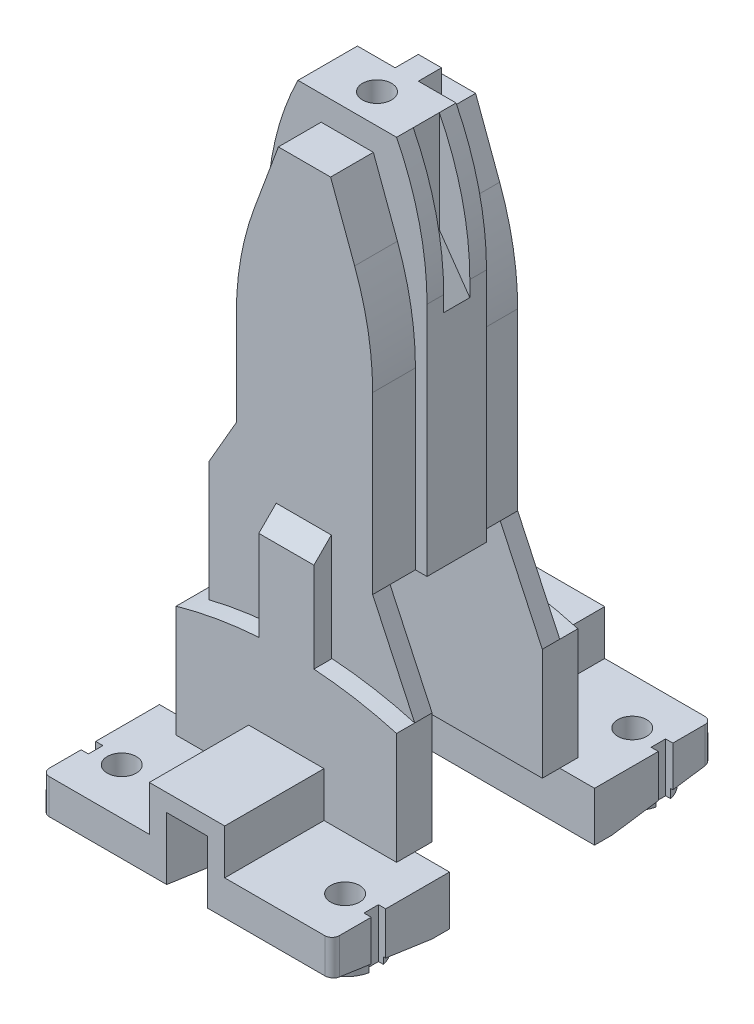
from build123d import *
from OCP.BRepFilletAPI import BRepFilletAPI_MakeChamfer

# Parameters (mm, degrees)
SKETCH1_W                 = 20
SKETCH1_H                 = 26.2
SKETCH1_R                 = 1
BOSS_EXTRUDE1_DEPTH       = 3.4
SKETCH2_W                 = 11
SKETCH2_H                 = 10
BOSS_EXTRUDE2_DEPTH       = 40.8
SKETCH3_W                 = 6.8
SKETCH3_H                 = 4.1
BOSS_EXTRUDE3_DEPTH       = 1.7
SKETCH4_R                 = 1
CUT_EXTRUDE1_DEPTH        = 2
CUT_EXTRUDE2_START        = -10
SKETCH6_W                 = 0.8
SKETCH6_H                 = 27.4
CUT_EXTRUDE2_DEPTH        = 10
BOSS_EXTRUDE4_DEPTH       = 4.1
SKETCH9_W                 = 3.7
SKETCH9_H                 = 4.1
BOSS_EXTRUDE5_DEPTH       = 37.4
SKETCH10_W                = 2.1
SKETCH10_H                = 1.8
CUT_EXTRUDE3_DEPTH        = 7
CHAMFER1_SIZE             = 3
CHAMFER1_SIZE_2           = 2.1
FILLET1_R                 = 20
FILLET2_R                 = 20
SKETCH11_W                = 15.2
SKETCH11_H                = 12.5
BOSS_EXTRUDE6_DEPTH       = 7.7
SKETCH12_W                = 6.6
SKETCH12_H                = 10
BOSS_EXTRUDE7_DEPTH       = 12.5
CHAMFER2_SIZE             = 4
CHAMFER2_SIZE_2           = 2.309401077
BOSS_EXTRUDE8_REACH       = 49.264
BOSS_EXTRUDE9_REACH       = 49.756
SKETCH16_W                = 3.480808908
SKETCH16_H                = 8.4
CUT_EXTRUDE4_DEPTH        = 49.763305876
SKETCH17_W                = 10
SKETCH17_H                = 3.4
CUT_EXTRUDE5_DEPTH        = 49.763305876
BOSS_EXTRUDE10_START      = -26.2
BOSS_EXTRUDE10_DEPTH      = 26.2
SKETCH19_W                = 3.480808908
SKETCH19_H                = 4.2
CUT_EXTRUDE6_DEPTH        = 48.829070658
SKETCH20_W                = 2.8
SKETCH20_H                = 3.4
CUT_EXTRUDE7_DEPTH        = 6.85
SKETCH21_W                = 2.8
SKETCH21_H                = 3.4
CUT_EXTRUDE8_DEPTH        = 6.85
BOSS_EXTRUDE11_START      = -1.2
BOSS_EXTRUDE11_DEPTH      = 1.2
CHAMFER3_SIZE             = 1.2
CHAMFER3_OF_MIRROR10_SIZE = 1.2
FILLET3_R                 = 0.5
CUT_EXTRUDE10_DEPTH       = 49.763305876
CUT_EXTRUDE10_DEPTH_BACK  = 49.763305876
BOSS_EXTRUDE12_START      = -3.4
SKETCH26_R                = 2.2
SKETCH26_R_2              = 1
BOSS_EXTRUDE12_DEPTH      = 3.4
SKETCH27_W                = 1.6
SKETCH27_H                = 1.6
BOSS_EXTRUDE13_DEPTH      = 1.7
CUT_EXTRUDE12_DEPTH       = 29
CUT_EXTRUDE12_DEPTH_BACK  = 10.1
SKETCH28_W                = 7.6
SKETCH28_H                = 15
FILLET4_R                 = 0.5
SKETCH29_W                = 0.5
SKETCH29_H                = 1
CUT_EXTRUDE13_DEPTH       = 43.43135633


# Some blends are built 0.0001 mm under size
with BuildPart() as part:
    # Sketch1 → Boss-Extrude1 (new body)
    with BuildSketch(Plane(origin=(0, 0, 0), x_dir=(1, 0, 0), z_dir=(0, 1, 0))):
        Rectangle(SKETCH1_W, SKETCH1_H)
        with Locations(Location((7.7, 9.9, 0), (0, 0, 270))):
            Circle(SKETCH1_R, mode=Mode.SUBTRACT)
        with Locations(Location((-7.7, 9.9, 0), (0, 0, 90))):
            Circle(SKETCH1_R, mode=Mode.SUBTRACT)
        with Locations(Location((7.7, -9.9, 0), (0, 0, 90))):
            Circle(SKETCH1_R, mode=Mode.SUBTRACT)
        with Locations(Location((-7.7, -9.9, 0), (0, 0, 270))):
            Circle(SKETCH1_R, mode=Mode.SUBTRACT)
    extrude(amount=BOSS_EXTRUDE1_DEPTH)

    # Sketch2 → Boss-Extrude2 (add)
    with BuildSketch(Plane.XZ):
        Rectangle(SKETCH2_W, SKETCH2_H)
    extrude(amount=-BOSS_EXTRUDE2_DEPTH)

    # Sketch3 → Boss-Extrude3 (add)
    with BuildSketch(Plane(origin=(0, 40.8, 0), x_dir=(1, 0, 0), z_dir=(0, 1, 0))):
        Rectangle(SKETCH3_W, SKETCH3_H)
    extrude(amount=BOSS_EXTRUDE3_DEPTH)

    # Sketch4 → Cut-Extrude1 (cut)
    with BuildSketch(Plane(origin=(0, 42.5, 0), x_dir=(1, 0, 0), z_dir=(0, 1, 0))):
        with Locations(Location((0, 0, 0), (0, 0, 270))):
            Circle(SKETCH4_R)
    extrude(amount=-CUT_EXTRUDE1_DEPTH, mode=Mode.SUBTRACT)

    # Sketch6 → Cut-Extrude2 (cut)
    with BuildSketch(Plane.XY.offset(5).offset(CUT_EXTRUDE2_START)):
        with Locations((-5.1, 17.1)):
            Rectangle(SKETCH6_W, SKETCH6_H)
        Polygon((-5.5, 30.8), (-4.7, 32.962162162), (-4.7, 40.8), (-5.5, 40.8), align=None)
        Polygon((-4.7, 30.8), (-4.7, 32.962162162), (-5.5, 30.8), align=None)
        Polygon((-4.7, 32.962162162), (-1.8, 40.8), (-4.7, 40.8), align=None)
        Polygon((4.7, 40.8), (1.8, 40.8), (4.7, 32.962162162), align=None)
        Polygon((5.5, 40.8), (4.7, 40.8), (4.7, 32.962162162), (5.5, 30.8), align=None)
        Polygon((5.5, 30.8), (4.7, 32.962162162), (4.7, 30.8), align=None)
        with Locations((5.1, 17.1)):
            Rectangle(SKETCH6_W, SKETCH6_H)
    cut_extrude2 = extrude(amount=CUT_EXTRUDE2_DEPTH, mode=Mode.SUBTRACT)

    # Sketch7 → Boss-Extrude4 (add)
    with BuildSketch(Plane.XY.offset(2.05)):
        Polygon((-3.4, 42.5), (-5.5, 40.8), (-3.4, 40.8), align=None)
        Polygon((3.4, 42.5), (3.4, 40.8), (5.5, 40.8), align=None)
    extrude(amount=-BOSS_EXTRUDE4_DEPTH)

    # Mirror6: Cut-Extrude2 across plane
    add(cut_extrude2.mirror(Plane.XY), mode=Mode.SUBTRACT)

    # Sketch9 → Boss-Extrude5 (add)
    with BuildSketch(Plane.XZ.offset(-40.8)):
        with Locations((3.65, 0)):
            Rectangle(SKETCH9_W, SKETCH9_H)
        with Locations((-3.65, 0)):
            Rectangle(SKETCH9_W, SKETCH9_H)
    extrude(amount=BOSS_EXTRUDE5_DEPTH)

    # Sketch10 → Cut-Extrude3 (cut)
    with BuildSketch(Plane(origin=(0, 42.5, 0), x_dir=(1, 0, 0), z_dir=(0, 1, 0))):
        with Locations((4.45, 0)):
            Rectangle(SKETCH10_W, SKETCH10_H)
        with Locations((-4.45, 0)):
            Rectangle(SKETCH10_W, SKETCH10_H)
    extrude(amount=-CUT_EXTRUDE3_DEPTH, mode=Mode.SUBTRACT)

    # Chamfer1
    chamfer1_edges_1 = [part.edges().sort_by_distance(p)[0] for p in [
        (-5.5, 35.5, 0),
    ]]
    chamfer1_side_1 = [part.faces().sort_by_distance(p)[0] for p in [
        (-5.5, 35.458, 0),
    ]]
    chamfer1_edges_2 = [part.edges().sort_by_distance(p)[0] for p in [
        (5.5, 35.5, 0),
    ]]
    chamfer1_side_2 = [part.faces().sort_by_distance(p)[0] for p in [
        (5.5, 35.458, 0),
    ]]
    chamfer1 = BRepFilletAPI_MakeChamfer(part.part.solid().wrapped)
    for e in chamfer1_edges_1:
        chamfer1.Add(CHAMFER1_SIZE - 0.0001, CHAMFER1_SIZE_2 - 0.0001, e.wrapped, chamfer1_side_1[0].wrapped)
    for e in chamfer1_edges_2:
        chamfer1.Add(CHAMFER1_SIZE - 0.0001, CHAMFER1_SIZE_2 - 0.0001, e.wrapped, chamfer1_side_2[0].wrapped)
    add(Compound.cast(chamfer1.Shape()), mode=Mode.REPLACE)  # a hair under: the kernel refuses the full size

    # Fillet1
    # the kernel refuses this fillet: 20 mm, written as the material it takes off along each edge
    with BuildSketch(Plane(origin=(5.5, 40.8, 17.15330693), x_dir=(-0.7772448707074852, 0.6291982286679648, 0), z_dir=(0, 0, -1))) as fillet1_piece_1:
        with BuildLine():
            CenterArc((11.001253917, -18.196700658), FILLET1_R, 114.517435757, 26.4915702)
            Line((-4.543643497, -5.612736084), (-4.854541445, -5.361056793))
            Line((-4.854541445, -5.361056793), (-0.310897948, 0.251679291))
            Line((-0.310897948, 0.251679291), (0, 0.4))
            ThreePointArc((0, 0.4), (1.350925609, 0.4), (2.535863163, 0.363934013))
            Line((2.535863163, 0.363934013), (2.701851217, 0))
        make_face()
    extrude(amount=37.256613859, mode=Mode.SUBTRACT)
    with BuildSketch(Plane(origin=(5.5, 40.8, 20.10330693), x_dir=(0, -1, 0), z_dir=(0, 0, -1))) as fillet1_piece_2:
        with BuildLine():
            CenterArc((7.221322772, 20), FILLET1_R, 243.5084298, 26.4915702)
            Line((-1.7, 2.1), (-1.878426455, 1.742))
            ThreePointArc((-1.878426455, 1.742), (-1.160897948, 0.798320709), (-0.310897948, -0.251679291))
            Line((-0.310897948, -0.251679291), (0, -0.4))
            Line((0, -0.4), (7.221322772, -0.4))
            Line((7.221322772, -0.4), (7.221322772, 0))
        make_face()
    extrude(amount=37.256613859, mode=Mode.SUBTRACT)
    with BuildSketch(Plane(origin=(-5.5, 40.8, 20.10330693), x_dir=(0, -1, 0), z_dir=(0, 0, -1)), Plane(origin=(-5.5, 40.8, 17.15330693), x_dir=(0, -1, 0), z_dir=(0, 0, -1))) as fillet1_piece_3:
        with BuildLine():
            CenterArc((7.221322772, -20), FILLET1_R, 90, 26.4915702)
            Line((-1.7, -2.1), (-1.878426455, -1.742))
            ThreePointArc((-1.878426455, -1.742), (-1.160897948, -0.798320709), (-0.310897948, 0.251679291))
            Line((-0.310897948, 0.251679291), (0, 0.4))
            Line((0, 0.4), (7.221322772, 0.4))
            Line((7.221322772, 0.4), (7.221322772, 0))
        make_face()
    extrude(amount=37.256613859, mode=Mode.SUBTRACT)

    # Fillet2
    fillet2_edges = [part.edges().sort_by_distance(p)[0] for p in [
        (4.7, 32.962162162, 3.525),
        (-4.7, 32.962162162, 3.525),
        (-4.7, 32.962162162, -3.525),
        (4.7, 32.962162162, -3.525),
    ]]
    fillet(fillet2_edges, radius=FILLET2_R)

    # Sketch11 → Boss-Extrude6 (add)
    with BuildSketch(Plane(origin=(0, 3.4, 0), x_dir=(1, 0, 0), z_dir=(0, 1, 0))):
        Rectangle(SKETCH11_W, SKETCH11_H)
    extrude(amount=BOSS_EXTRUDE6_DEPTH)

    # Sketch12 → Boss-Extrude7 (add)
    with BuildSketch(Plane(origin=(0, 11.1, 0), x_dir=(1, 0, 0), z_dir=(0, 1, 0))):
        with Locations((-3.3, 0)):
            Rectangle(SKETCH12_W, SKETCH12_H)
    extrude(amount=BOSS_EXTRUDE7_DEPTH)

    # Chamfer2
    # the kernel refuses this chamfer: 4, 2.309401077 mm, written as the material it takes off along each edge
    with BuildSketch(Plane(origin=(-6.6, 23.6, -15.348343019), x_dir=(-0.01932676561270072, -0.9998132206222079, 0), z_dir=(0, 0, 1))) as chamfer2_piece_1_section:
        Polygon((CHAMFER2_SIZE * 0.999813220622, CHAMFER2_SIZE * 0.0193267656127), (-CHAMFER2_SIZE_2 * 0.0193267656107, CHAMFER2_SIZE_2 * 0.999813220518), (0, 0), align=None)
    chamfer2_piece_1 = extrude(amount=30.696686037, mode=Mode.PRIVATE)
    chamfer2_piece_1 = split(chamfer2_piece_1, bisect_by=Plane(origin=(-5.5, 22.026681043, -3.525), z_dir=(-1, 0, 0)), keep=Keep.TOP, mode=Mode.PRIVATE)
    add(chamfer2_piece_1, mode=Mode.SUBTRACT)
    with BuildSketch(Plane(origin=(-6.6, 23.6, -15.348343019), x_dir=(-0.01932676561270072, -0.9998132206222079, 0), z_dir=(0, 0, 1))) as chamfer2_piece_2_section:
        Polygon((CHAMFER2_SIZE * 0.999813220622, CHAMFER2_SIZE * 0.0193267656127), (-CHAMFER2_SIZE_2 * 0.0193267656107, CHAMFER2_SIZE_2 * 0.999813220518), (0, 0), align=None)
    chamfer2_piece_2 = extrude(amount=30.696686037, mode=Mode.PRIVATE)
    chamfer2_piece_2 = split(chamfer2_piece_2, bisect_by=Plane(origin=(-5.165892343, 22.841973663, -2.05), z_dir=(0, 0, -1)), keep=Keep.TOP, mode=Mode.PRIVATE)
    chamfer2_piece_2 = split(chamfer2_piece_2, bisect_by=Plane(origin=(-4.7, 22.841973663, -3.525), z_dir=(-1, 0, 0)), keep=Keep.TOP, mode=Mode.PRIVATE)
    add(chamfer2_piece_2, mode=Mode.SUBTRACT)
    with BuildSketch(Plane(origin=(-6.6, 23.6, -15.348343019), x_dir=(-0.01932676561270072, -0.9998132206222079, 0), z_dir=(0, 0, 1))) as chamfer2_piece_3_section:
        Polygon((CHAMFER2_SIZE * 0.999813220622, CHAMFER2_SIZE * 0.0193267656127), (-CHAMFER2_SIZE_2 * 0.0193267656107, CHAMFER2_SIZE_2 * 0.999813220518), (0, 0), align=None)
    chamfer2_piece_3 = extrude(amount=30.696686037, mode=Mode.PRIVATE)
    chamfer2_piece_3 = split(chamfer2_piece_3, bisect_by=Plane(origin=(-5.165892343, 22.841973663, 2.05), z_dir=(0, 0, 1)), keep=Keep.TOP, mode=Mode.PRIVATE)
    chamfer2_piece_3 = split(chamfer2_piece_3, bisect_by=Plane(origin=(-4.7, 22.841973663, 3.525), z_dir=(-1, 0, 0)), keep=Keep.TOP, mode=Mode.PRIVATE)
    add(chamfer2_piece_3, mode=Mode.SUBTRACT)

    # Boss-Extrude8: up to this face of the body (flat: up to its plane)
    boss_extrude8_end = Plane(part.part.faces().sort_by_distance((-0.39355153, 24.213344947, -5))[0])
    # Sketch14 → Boss-Extrude8 (add, up to the picked face)
    with BuildSketch(Plane.XY.offset(5), mode=Mode.PRIVATE) as boss_extrude8_sk1:
        Polygon((4.7, 11.1), (7.6, 11.1), (4.7, 17.319070069), align=None)
    boss_extrude8_tool1 = split(extrude(boss_extrude8_sk1.sketch, amount=-BOSS_EXTRUDE8_REACH, mode=Mode.PRIVATE), bisect_by=boss_extrude8_end, keep=Keep.BOTH, mode=Mode.PRIVATE)
    add(boss_extrude8_tool1.solids().sort_by(Axis((5.666667, 13.173023, 5), (0, 0, -1)))[0])

    # Boss-Extrude9: up to this face of the body (flat: up to its plane)
    boss_extrude9_end = Plane(part.part.faces().sort_by_distance((0, 7.25, -6.25))[0])
    # Sketch15 → Boss-Extrude9 (add, up to the picked face)
    with BuildSketch(Plane.XY.offset(6.25), mode=Mode.PRIVATE) as boss_extrude9_sk1:
        with BuildLine():
            ThreePointArc((7.6, 11.1), (0, 12.156989625), (-7.6, 11.1))
            Line((-7.6, 11.1), (7.6, 11.1))
        make_face()
    boss_extrude9_tool1 = split(extrude(boss_extrude9_sk1.sketch, amount=-BOSS_EXTRUDE9_REACH, mode=Mode.PRIVATE), bisect_by=boss_extrude9_end, keep=Keep.BOTH, mode=Mode.PRIVATE)
    add(boss_extrude9_tool1.solids().sort_by(Axis((0, 11.523491, 6.25), (0, 0, -1)))[0])

    # Sketch16 → Cut-Extrude4 (cut, through all)
    with BuildSketch(Plane(origin=(10, 0, 0), x_dir=(0, 0, -1), z_dir=(1, 0, 0))):
        with Locations((0, 3.4)):
            Rectangle(SKETCH16_W, SKETCH16_H)
    extrude(amount=-CUT_EXTRUDE4_DEPTH, mode=Mode.SUBTRACT)

    # Sketch17 → Cut-Extrude5 (cut, through all)
    with BuildSketch(Plane(origin=(10, 0, 0), x_dir=(0, 0, -1), z_dir=(1, 0, 0))):
        with Locations((0, 1.7)):
            Rectangle(SKETCH17_W, SKETCH17_H)
    extrude(amount=-CUT_EXTRUDE5_DEPTH, mode=Mode.SUBTRACT)

    # Sketch18 → Boss-Extrude10 (add)
    with BuildSketch(Plane(origin=(0, 0, -13.1), x_dir=(-1, 0, 0), z_dir=(0, 0, -1)).offset(BOSS_EXTRUDE10_START)):
        Polygon((-2.6, 6.5), (-2.6, 3.4), (-1.4, 3.4), (-1.4, 5.3), (1.4, 5.3), (1.4, 3.4), (2.6, 3.4), (2.6, 6.5), align=None)
    boss_extrude10 = extrude(amount=BOSS_EXTRUDE10_DEPTH)

    # Mirror7: Boss-Extrude10 across plane
    add(boss_extrude10.mirror(Plane.XY))

    # Sketch19 → Cut-Extrude6 (cut, through all)
    with BuildSketch(Plane.ZY.offset(7.6)):
        with Locations((0, 5.5)):
            Rectangle(SKETCH19_W, SKETCH19_H)
    extrude(amount=-CUT_EXTRUDE6_DEPTH, mode=Mode.SUBTRACT)

    # Sketch20 → Cut-Extrude7 (cut)
    with BuildSketch(Plane(origin=(0, 0, -13.1), x_dir=(-1, 0, 0), z_dir=(0, 0, -1))):
        with Locations((0, 1.7)):
            Rectangle(SKETCH20_W, SKETCH20_H)
    extrude(amount=-CUT_EXTRUDE7_DEPTH, mode=Mode.SUBTRACT)

    # Sketch21 → Cut-Extrude8 (cut)
    with BuildSketch(Plane.XY.offset(13.1)):
        with Locations((0, 1.7)):
            Rectangle(SKETCH21_W, SKETCH21_H)
    extrude(amount=-CUT_EXTRUDE8_DEPTH, mode=Mode.SUBTRACT)

    # Sketch22 → Boss-Extrude11 (add)
    with BuildSketch(Plane(origin=(0, 0, -6.25), x_dir=(-1, 0, 0), z_dir=(0, 0, -1)).offset(BOSS_EXTRUDE11_START)):
        with BuildLine():
            Line((-1.9, 19.5), (-1.9, 12.092105754))
            ThreePointArc((-1.9, 12.092105754), (0, 12.156989625), (1.9, 12.092105754))
            Line((1.9, 12.092105754), (1.9, 19.5))
            Line((1.9, 19.5), (-1.9, 19.5))
        make_face()
    boss_extrude11 = extrude(amount=BOSS_EXTRUDE11_DEPTH)

    # Chamfer3
    chamfer3_edges = [part.edges().sort_by_distance(p)[0] for p in [
        (0, 19.5, -6.25),
    ]]
    chamfer(chamfer3_edges, length=CHAMFER3_SIZE - 0.0001)  # a hair under: the kernel refuses the full size

    # Mirror10: Boss-Extrude11 across plane
    add(boss_extrude11.mirror(Plane.XY))

    # Chamfer3 of Mirror10
    chamfer3_of_mirror10_edges = [part.edges().sort_by_distance(p)[0] for p in [
        (0, 19.5, 6.25),
    ]]
    chamfer(chamfer3_of_mirror10_edges, length=CHAMFER3_OF_MIRROR10_SIZE - 0.0001)  # a hair under: the kernel refuses the full size

    # Fillet3
    fillet3_edges = [part.edges().sort_by_distance(p)[0] for p in [
        (0, 3.4, 1.740404454),
        (0, 3.4, -1.740404454),
    ]]
    fillet(fillet3_edges, radius=FILLET3_R)

    # Sketch25 → Cut-Extrude10 (cut, two sides: drawn at the far end of the back side and taken through both)
    with BuildSketch(Plane.ZY.offset(10).offset(-CUT_EXTRUDE10_DEPTH_BACK)):
        Polygon((-13.1, 0), (-13.1, 1), (-6.2, 0), align=None)
        Polygon((6.2, 0), (13.1, 0), (13.1, 1), align=None)
    extrude(amount=CUT_EXTRUDE10_DEPTH + CUT_EXTRUDE10_DEPTH_BACK, mode=Mode.SUBTRACT)

    # Sketch26 → Boss-Extrude12 (add)
    # profile 1 of 4: a face of its own
    with BuildSketch(Plane(origin=(0, 3.4, 0), x_dir=(1, 0, 0), z_dir=(0, 1, 0)).offset(BOSS_EXTRUDE12_START)):
        with Locations(Location((-7.7, 9.9, 0), (0, 0, 90))):
            Circle(SKETCH26_R)
        with Locations(Location((-7.7, 9.9, 0), (0, 0, 90))):
            Circle(SKETCH26_R_2, mode=Mode.SUBTRACT)
    # profile 2 of 4: a face of its own
    with BuildSketch(Plane(origin=(0, 3.4, 0), x_dir=(1, 0, 0), z_dir=(0, 1, 0)).offset(BOSS_EXTRUDE12_START)):
        with Locations(Location((7.7, 9.9, 0), (0, 0, 90))):
            Circle(SKETCH26_R)
        with Locations(Location((7.7, 9.9, 0), (0, 0, 90))):
            Circle(SKETCH26_R_2, mode=Mode.SUBTRACT)
    # profile 3 of 4: a face of its own
    with BuildSketch(Plane(origin=(0, 3.4, 0), x_dir=(1, 0, 0), z_dir=(0, 1, 0)).offset(BOSS_EXTRUDE12_START)):
        with Locations(Location((7.7, -9.9, 0), (0, 0, 270))):
            Circle(SKETCH26_R)
        with Locations(Location((7.7, -9.9, 0), (0, 0, 90))):
            Circle(SKETCH26_R_2, mode=Mode.SUBTRACT)
    # profile 4 of 4: a face of its own
    with BuildSketch(Plane(origin=(0, 3.4, 0), x_dir=(1, 0, 0), z_dir=(0, 1, 0)).offset(BOSS_EXTRUDE12_START)):
        with Locations(Location((-7.7, -9.9, 0), (0, 0, 270))):
            Circle(SKETCH26_R)
        with Locations(Location((-7.7, -9.9, 0), (0, 0, 90))):
            Circle(SKETCH26_R_2, mode=Mode.SUBTRACT)
    extrude(amount=BOSS_EXTRUDE12_DEPTH)

    # Sketch27 → Boss-Extrude13 (add)
    with BuildSketch(Plane(origin=(0, 40.8, 0), x_dir=(1, 0, 0), z_dir=(0, 1, 0))):
        with Locations((0, 2.85)):
            Rectangle(SKETCH27_W, SKETCH27_H)
    extrude(amount=BOSS_EXTRUDE13_DEPTH)

    # Sketch28 → Cut-Extrude12 (cut, two sides: drawn at the far end of the back side and taken through both)
    with BuildSketch(Plane(origin=(4.7, 0, 0), x_dir=(0, 0, -1), z_dir=(1, 0, 0)).offset(-CUT_EXTRUDE12_DEPTH_BACK)):
        with Locations((0, 9.819070069)):
            Rectangle(SKETCH28_W, SKETCH28_H)
    extrude(amount=CUT_EXTRUDE12_DEPTH + CUT_EXTRUDE12_DEPTH_BACK, mode=Mode.SUBTRACT)

    # Fillet4
    fillet4_edges = [part.edges().sort_by_distance(p)[0] for p in [
        (10, 2.2, -13.1),
        (10, 2.2, 13.1),
        (-10, 2.2, -13.1),
        (-10, 2.2, 13.1),
    ]]
    fillet(fillet4_edges, radius=FILLET4_R)

    # Sketch29 → Cut-Extrude13 (cut, through all)
    with BuildSketch(Plane(origin=(0, 3.4, 0), x_dir=(1, 0, 0), z_dir=(0, 1, 0))):
        with Locations((9.75, -9.9)):
            Rectangle(SKETCH29_W, SKETCH29_H)
        with Locations((-9.75, -9.9)):
            Rectangle(SKETCH29_W, SKETCH29_H)
        with Locations((9.75, 9.9)):
            Rectangle(SKETCH29_W, SKETCH29_H)
        with Locations((-9.75, 9.9)):
            Rectangle(SKETCH29_W, SKETCH29_H)
    extrude(amount=-CUT_EXTRUDE13_DEPTH, mode=Mode.SUBTRACT)


solid = part.part
